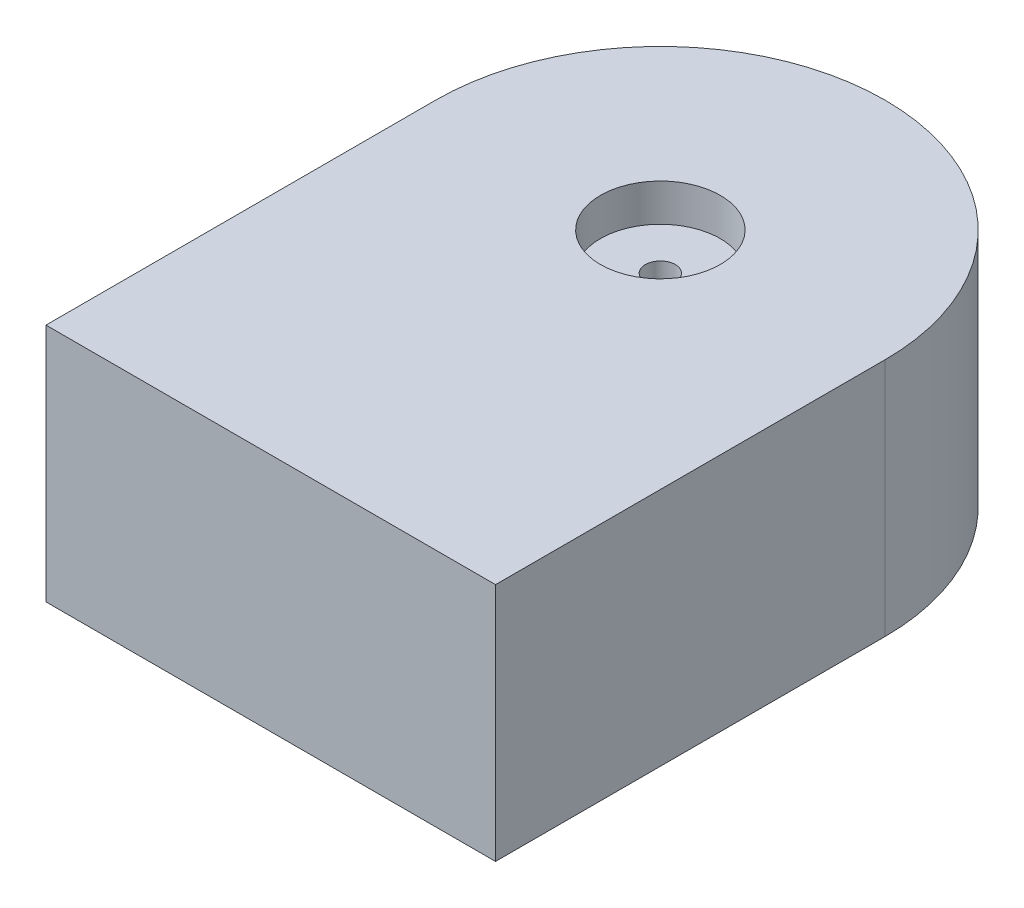
from build123d import *

# Parameters (mm, degrees)
ESQUISSE1_W             = 30
ESQUISSE1_H             = 41
EXTRUSION1_DEPTH        = 16
CONG_1_R                = 15
ESQUISSE3_R             = 4
ENL_V_MAT_EXTRU_1_DEPTH = 2.5
ESQUISSE4_R             = 1
ENL_V_MAT_EXTRU_2_DEPTH = 53.566624392


with BuildPart() as part:
    # Esquisse1 → Extrusion1 (new body)
    with BuildSketch(Plane(origin=(0, 0, 0), x_dir=(1, 0, 0), z_dir=(0, 1, 0))):
        with Locations((15, 20.5)):
            Rectangle(ESQUISSE1_W, ESQUISSE1_H)
    extrude(amount=EXTRUSION1_DEPTH)

    # Congé1
    cong_1_edges = [part.edges().sort_by_distance(p)[0] for p in [
        (30, 8, -41),
        (0, 8, -41),
    ]]
    fillet(cong_1_edges, radius=CONG_1_R - 0.0001)  # a hair under: the kernel refuses the full size

    # Esquisse3 → Enlèv. mat.-Extru.1 (cut)
    with BuildSketch(Plane(origin=(0, 16, 0), x_dir=(1, 0, 0), z_dir=(0, 1, 0))):
        with Locations(Location((15, 26, 0), (0, 0, 270))):
            Circle(ESQUISSE3_R)
    extrude(amount=-ENL_V_MAT_EXTRU_1_DEPTH, mode=Mode.SUBTRACT)

    # Esquisse4 → Enlèv. mat.-Extru.2 (cut, through all)
    with BuildSketch(Plane(origin=(0, 13.5, 0), x_dir=(1, 0, 0), z_dir=(0, 1, 0))):
        with Locations(Location((15, 26, 0), (0, 0, 270))):
            Circle(ESQUISSE4_R)
    extrude(amount=-ENL_V_MAT_EXTRU_2_DEPTH, mode=Mode.SUBTRACT)


solid = part.part
